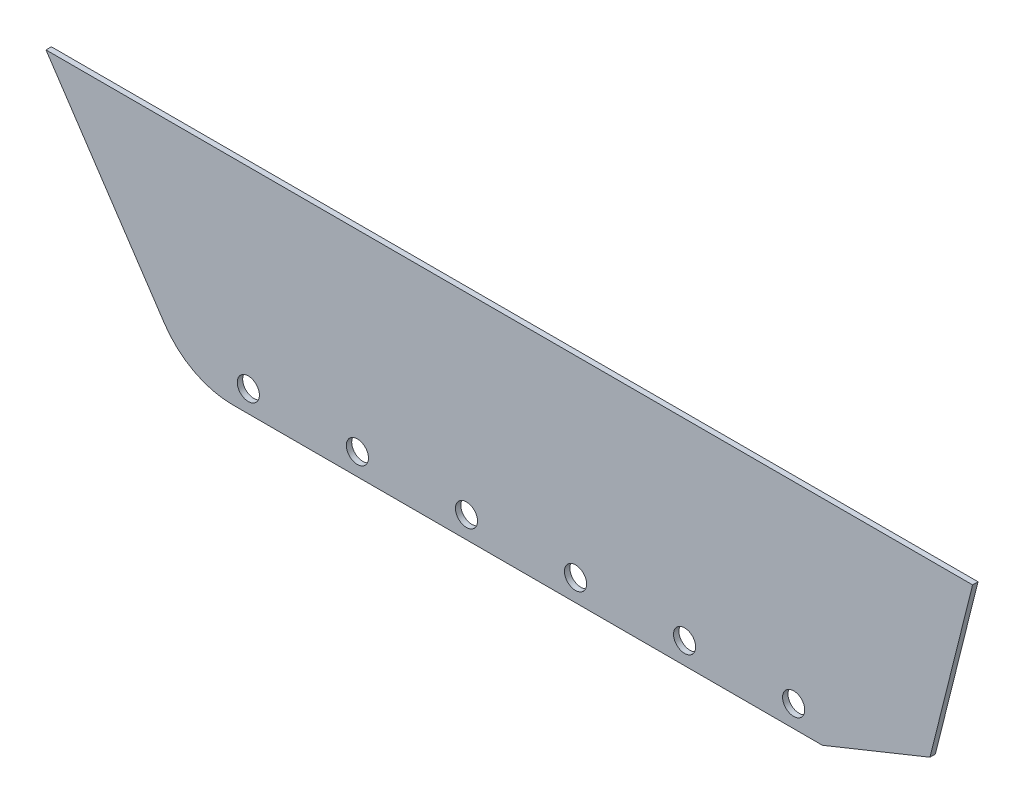
from build123d import *

# Parameters (mm, degrees)
BOSS_EXTRUDE1_DEPTH = 3.175
SKETCH1_4_R         = 6.5
CUT_EXTRUDE1_DEPTH  = 439.905857431
FILLET1_R           = 48
CUT_EXTRUDE3_DEPTH  = 10


with BuildPart() as part:
    # Sketch1 → Boss-Extrude1 (new body)
    with BuildSketch(Plane.XY):
        Polygon((-98.879411765, 3.850980392), (-31.879411765, -96.649019608), (366, -96.649019608), (403.120588235, -71.149019608), (428.120588235, 28.939617947), (-115.605170134, 28.939617947), align=None)
    extrude(amount=BOSS_EXTRUDE1_DEPTH)

    # Sketch1<4> → Cut-Extrude1 (cut, through all)
    with BuildSketch(Plane.XY):
        with Locations((3.120588235, -83.899019608)):
            Circle(SKETCH1_4_R)
        with Locations((67.120588235, -83.899019608)):
            Circle(SKETCH1_4_R)
        with Locations((131.120588235, -83.899019608)):
            Circle(SKETCH1_4_R)
        with Locations((195.120588235, -83.899019608)):
            Circle(SKETCH1_4_R)
        with Locations((259.120588235, -83.899019608)):
            Circle(SKETCH1_4_R)
        with Locations((323.120588235, -83.899019608)):
            Circle(SKETCH1_4_R)
    extrude(amount=CUT_EXTRUDE1_DEPTH, mode=Mode.SUBTRACT)

    # Fillet1
    fillet1_edges = [part.edges().sort_by_distance(p)[0] for p in [
        (-31.879411765, -96.649019608, 1.5875),
    ]]
    fillet(fillet1_edges, radius=FILLET1_R)

    # Sketch7 → Cut-Extrude3 (cut)
    with BuildSketch(Plane.XY.offset(3.175)):
        Polygon((403.120588235, -71.149019608), (340.005873473, -96.649019608), (366, -96.649019608), align=None)
    extrude(amount=-CUT_EXTRUDE3_DEPTH, mode=Mode.SUBTRACT)


solid = part.part
